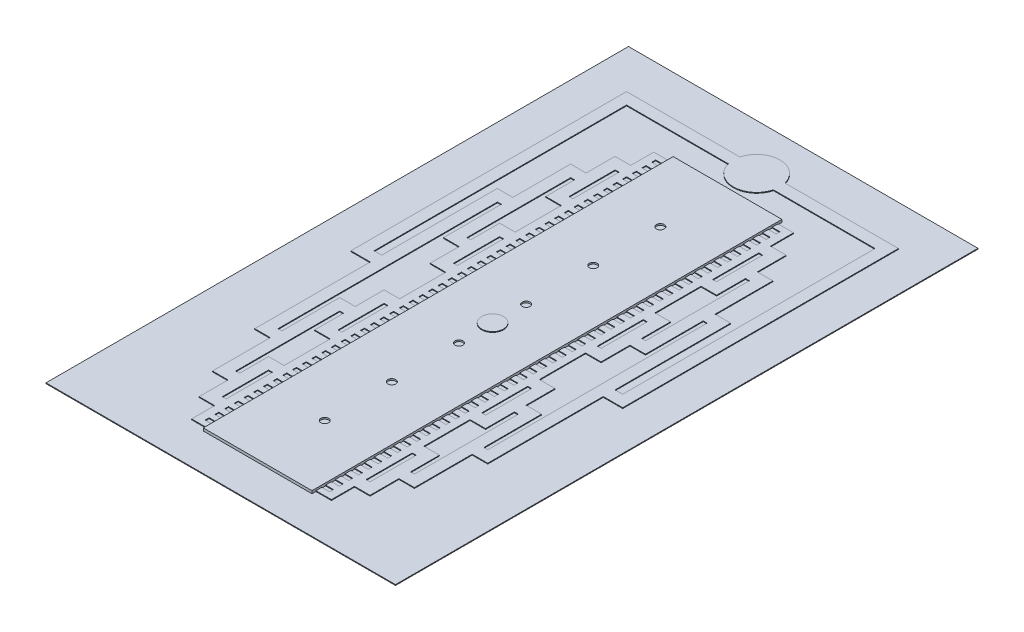
from build123d import *

# Parameters (mm, degrees)
SKETCH2_W           = 45
SKETCH2_H           = 75
BOSS_EXTRUDE1_DEPTH = 0.1
SKETCH3_W           = 14
SKETCH3_H           = 60.5
BOSS_EXTRUDE2_DEPTH = 0.35
SKETCH4_W           = 2
SKETCH4_H           = 59.5
BOSS_EXTRUDE3_DEPTH = 0.1
SKETCH5_W           = 1
SKETCH5_H           = 0.5
CUT_EXTRUDE1_DEPTH  = 0.1
BOSS_EXTRUDE4_DEPTH = 0.1
SKETCH7_R           = 1.4
BOSS_EXTRUDE5_DEPTH = 0.1
SKETCH8_R           = 0.5
CUT_EXTRUDE2_DEPTH  = 0.2
SKETCH9_W           = 45.00373836
SKETCH9_H           = 0.1
CUT_EXTRUDE3_DEPTH  = 2.5
SKETCH10_W          = 45.001662642
SKETCH10_H          = 0.1
BOSS_EXTRUDE6_DEPTH = 2.5


with BuildPart() as part:
    # Sketch2 → Boss-Extrude1 (new body)
    with BuildSketch(Plane(origin=(0, 0, 0), x_dir=(1, 0, 0), z_dir=(0, 1, 0))):
        Rectangle(SKETCH2_W, SKETCH2_H)
    extrude(amount=BOSS_EXTRUDE1_DEPTH)

    # Sketch3 → Boss-Extrude2 (add)
    with BuildSketch(Plane(origin=(0, 0.1, 0), x_dir=(1, 0, 0), z_dir=(0, 1, 0))):
        Rectangle(SKETCH3_W, SKETCH3_H)
    extrude(amount=BOSS_EXTRUDE2_DEPTH)

    # Sketch4 → Boss-Extrude3 (add)
    with BuildSketch(Plane(origin=(0, 0.1, 0), x_dir=(1, 0, 0), z_dir=(0, 1, 0))):
        with Locations((8, 0)):
            Rectangle(SKETCH4_W, SKETCH4_H)
        with Locations((-8, 0)):
            Rectangle(SKETCH4_W, SKETCH4_H)
    extrude(amount=BOSS_EXTRUDE3_DEPTH)

    # Sketch5 → Cut-Extrude1 (cut)
    with BuildSketch(Plane(origin=(0, 0.2, 0), x_dir=(1, 0, 0), z_dir=(0, 1, 0))):
        with Locations((7.5, 28.75)):
            Rectangle(SKETCH5_W, SKETCH5_H)
        with Locations((-7.5, 28.75)):
            Rectangle(SKETCH5_W, SKETCH5_H)
        with Locations((-7.5, 27.5)):
            Rectangle(SKETCH5_W, SKETCH5_H)
        with Locations((-7.5, 26.25)):
            Rectangle(SKETCH5_W, SKETCH5_H)
        with Locations((-7.5, 25)):
            Rectangle(SKETCH5_W, SKETCH5_H)
        with Locations((-7.5, 23.75)):
            Rectangle(SKETCH5_W, SKETCH5_H)
        with Locations((-7.5, 22.5)):
            Rectangle(SKETCH5_W, SKETCH5_H)
        with Locations((-7.5, 21.25)):
            Rectangle(SKETCH5_W, SKETCH5_H)
        with Locations((-7.5, 20)):
            Rectangle(SKETCH5_W, SKETCH5_H)
        with Locations((-7.5, 18.75)):
            Rectangle(SKETCH5_W, SKETCH5_H)
        with Locations((-7.5, 17.5)):
            Rectangle(SKETCH5_W, SKETCH5_H)
        with Locations((-7.5, 16.25)):
            Rectangle(SKETCH5_W, SKETCH5_H)
        with Locations((-7.5, 15)):
            Rectangle(SKETCH5_W, SKETCH5_H)
        with Locations((-7.5, 13.75)):
            Rectangle(SKETCH5_W, SKETCH5_H)
        with Locations((-7.5, 12.5)):
            Rectangle(SKETCH5_W, SKETCH5_H)
        with Locations((-7.5, 11.25)):
            Rectangle(SKETCH5_W, SKETCH5_H)
        with Locations((-7.5, 10)):
            Rectangle(SKETCH5_W, SKETCH5_H)
        with Locations((-7.5, 8.75)):
            Rectangle(SKETCH5_W, SKETCH5_H)
        with Locations((-7.5, 7.5)):
            Rectangle(SKETCH5_W, SKETCH5_H)
        with Locations((-7.5, 6.25)):
            Rectangle(SKETCH5_W, SKETCH5_H)
        with Locations((-7.5, 5)):
            Rectangle(SKETCH5_W, SKETCH5_H)
        with Locations((-7.5, 3.75)):
            Rectangle(SKETCH5_W, SKETCH5_H)
        with Locations((-7.5, 2.5)):
            Rectangle(SKETCH5_W, SKETCH5_H)
        with Locations((-7.5, 1.25)):
            Rectangle(SKETCH5_W, SKETCH5_H)
        with Locations((-7.5, 0)):
            Rectangle(SKETCH5_W, SKETCH5_H)
        with Locations((-7.5, -1.25)):
            Rectangle(SKETCH5_W, SKETCH5_H)
        with Locations((-7.5, -2.5)):
            Rectangle(SKETCH5_W, SKETCH5_H)
        with Locations((-7.5, -3.75)):
            Rectangle(SKETCH5_W, SKETCH5_H)
        with Locations((-7.5, -5)):
            Rectangle(SKETCH5_W, SKETCH5_H)
        with Locations((-7.5, -6.25)):
            Rectangle(SKETCH5_W, SKETCH5_H)
        with Locations((-7.5, -7.5)):
            Rectangle(SKETCH5_W, SKETCH5_H)
        with Locations((-7.5, -8.75)):
            Rectangle(SKETCH5_W, SKETCH5_H)
        with Locations((-7.5, -10)):
            Rectangle(SKETCH5_W, SKETCH5_H)
        with Locations((-7.5, -11.25)):
            Rectangle(SKETCH5_W, SKETCH5_H)
        with Locations((-7.5, -12.5)):
            Rectangle(SKETCH5_W, SKETCH5_H)
        with Locations((-7.5, -13.75)):
            Rectangle(SKETCH5_W, SKETCH5_H)
        with Locations((-7.5, -15)):
            Rectangle(SKETCH5_W, SKETCH5_H)
        with Locations((-7.5, -16.25)):
            Rectangle(SKETCH5_W, SKETCH5_H)
        with Locations((-7.5, -17.5)):
            Rectangle(SKETCH5_W, SKETCH5_H)
        with Locations((-7.5, -18.75)):
            Rectangle(SKETCH5_W, SKETCH5_H)
        with Locations((-7.5, -20)):
            Rectangle(SKETCH5_W, SKETCH5_H)
        with Locations((-7.5, -21.25)):
            Rectangle(SKETCH5_W, SKETCH5_H)
        with Locations((-7.5, -22.5)):
            Rectangle(SKETCH5_W, SKETCH5_H)
        with Locations((-7.5, -23.75)):
            Rectangle(SKETCH5_W, SKETCH5_H)
        with Locations((-7.5, -25)):
            Rectangle(SKETCH5_W, SKETCH5_H)
        with Locations((-7.5, -26.25)):
            Rectangle(SKETCH5_W, SKETCH5_H)
        with Locations((-7.5, -27.5)):
            Rectangle(SKETCH5_W, SKETCH5_H)
        with Locations((-7.5, -28.75)):
            Rectangle(SKETCH5_W, SKETCH5_H)
        with Locations((7.5, 27.5)):
            Rectangle(SKETCH5_W, SKETCH5_H)
        with Locations((7.5, 26.25)):
            Rectangle(SKETCH5_W, SKETCH5_H)
        with Locations((7.5, 25)):
            Rectangle(SKETCH5_W, SKETCH5_H)
        with Locations((7.5, 23.75)):
            Rectangle(SKETCH5_W, SKETCH5_H)
        with Locations((7.5, 22.5)):
            Rectangle(SKETCH5_W, SKETCH5_H)
        with Locations((7.5, 21.25)):
            Rectangle(SKETCH5_W, SKETCH5_H)
        with Locations((7.5, 20)):
            Rectangle(SKETCH5_W, SKETCH5_H)
        with Locations((7.5, 18.75)):
            Rectangle(SKETCH5_W, SKETCH5_H)
        with Locations((7.5, 17.5)):
            Rectangle(SKETCH5_W, SKETCH5_H)
        with Locations((7.5, 16.25)):
            Rectangle(SKETCH5_W, SKETCH5_H)
        with Locations((7.5, 15)):
            Rectangle(SKETCH5_W, SKETCH5_H)
        with Locations((7.5, 13.75)):
            Rectangle(SKETCH5_W, SKETCH5_H)
        with Locations((7.5, 12.5)):
            Rectangle(SKETCH5_W, SKETCH5_H)
        with Locations((7.5, 11.25)):
            Rectangle(SKETCH5_W, SKETCH5_H)
        with Locations((7.5, 10)):
            Rectangle(SKETCH5_W, SKETCH5_H)
        with Locations((7.5, 8.75)):
            Rectangle(SKETCH5_W, SKETCH5_H)
        with Locations((7.5, 7.5)):
            Rectangle(SKETCH5_W, SKETCH5_H)
        with Locations((7.5, 6.25)):
            Rectangle(SKETCH5_W, SKETCH5_H)
        with Locations((7.5, 5)):
            Rectangle(SKETCH5_W, SKETCH5_H)
        with Locations((7.5, 3.75)):
            Rectangle(SKETCH5_W, SKETCH5_H)
        with Locations((7.5, 2.5)):
            Rectangle(SKETCH5_W, SKETCH5_H)
        with Locations((7.5, 1.25)):
            Rectangle(SKETCH5_W, SKETCH5_H)
        with Locations((7.5, 0)):
            Rectangle(SKETCH5_W, SKETCH5_H)
        with Locations((7.5, -1.25)):
            Rectangle(SKETCH5_W, SKETCH5_H)
        with Locations((7.5, -2.5)):
            Rectangle(SKETCH5_W, SKETCH5_H)
        with Locations((7.5, -3.75)):
            Rectangle(SKETCH5_W, SKETCH5_H)
        with Locations((7.5, -5)):
            Rectangle(SKETCH5_W, SKETCH5_H)
        with Locations((7.5, -6.25)):
            Rectangle(SKETCH5_W, SKETCH5_H)
        with Locations((7.5, -7.5)):
            Rectangle(SKETCH5_W, SKETCH5_H)
        with Locations((7.5, -8.75)):
            Rectangle(SKETCH5_W, SKETCH5_H)
        with Locations((7.5, -10)):
            Rectangle(SKETCH5_W, SKETCH5_H)
        with Locations((7.5, -11.25)):
            Rectangle(SKETCH5_W, SKETCH5_H)
        with Locations((7.5, -12.5)):
            Rectangle(SKETCH5_W, SKETCH5_H)
        with Locations((7.5, -13.75)):
            Rectangle(SKETCH5_W, SKETCH5_H)
        with Locations((7.5, -15)):
            Rectangle(SKETCH5_W, SKETCH5_H)
        with Locations((7.5, -16.25)):
            Rectangle(SKETCH5_W, SKETCH5_H)
        with Locations((7.5, -17.5)):
            Rectangle(SKETCH5_W, SKETCH5_H)
        with Locations((7.5, -18.75)):
            Rectangle(SKETCH5_W, SKETCH5_H)
        with Locations((7.5, -20)):
            Rectangle(SKETCH5_W, SKETCH5_H)
        with Locations((7.5, -21.25)):
            Rectangle(SKETCH5_W, SKETCH5_H)
        with Locations((7.5, -22.5)):
            Rectangle(SKETCH5_W, SKETCH5_H)
        with Locations((7.5, -23.75)):
            Rectangle(SKETCH5_W, SKETCH5_H)
        with Locations((7.5, -25)):
            Rectangle(SKETCH5_W, SKETCH5_H)
        with Locations((7.5, -26.25)):
            Rectangle(SKETCH5_W, SKETCH5_H)
        with Locations((7.5, -27.5)):
            Rectangle(SKETCH5_W, SKETCH5_H)
        with Locations((7.5, -28.75)):
            Rectangle(SKETCH5_W, SKETCH5_H)
    extrude(amount=-CUT_EXTRUDE1_DEPTH, mode=Mode.SUBTRACT)

    # Sketch6 → Boss-Extrude4 (add)
    with BuildSketch(Plane(origin=(0, 0.1, 0), x_dir=(1, 0, 0), z_dir=(0, 1, 0))):
        with BuildLine():
            Line((-2.90473751, 34.75), (-17.5, 34.75))
            Line((-17.5, 34.75), (-17.5, -0.75))
            Line((-17.5, -0.75), (-15, -0.75))
            Line((-15, -0.75), (-15, -15.625))
            Line((-15, -15.625), (-13, -15.625))
            Line((-13, -15.625), (-13, -23.0625))
            Line((-13, -23.0625), (-11, -23.0625))
            Line((-11, -23.0625), (-11, -26.78125))
            Line((-11, -26.78125), (-9, -26.78125))
            Line((-9, -26.78125), (-9, -25.28125))
            Line((-9, -25.28125), (-9.5, -25.28125))
            Line((-9.5, -25.28125), (-9.5, -19.34375))
            Line((-9.5, -19.34375), (-9, -19.34375))
            Line((-9, -19.34375), (-9, -17.84375))
            Line((-9, -17.84375), (-11, -17.84375))
            Line((-11, -17.84375), (-11, -21.5625))
            Line((-11, -21.5625), (-11.5, -21.5625))
            Line((-11.5, -21.5625), (-11.5, -8.1875))
            Line((-11.5, -8.1875), (-11, -8.1875))
            Line((-11, -8.1875), (-11, -11.90625))
            Line((-11, -11.90625), (-9, -11.90625))
            Line((-9, -11.90625), (-9, -10.40625))
            Line((-9, -10.40625), (-9.5, -10.40625))
            Line((-9.5, -10.40625), (-9.5, -4.46875))
            Line((-9.5, -4.46875), (-9, -4.46875))
            Line((-9, -4.46875), (-9, -2.96875))
            Line((-9, -2.96875), (-11, -2.96875))
            Line((-11, -2.96875), (-11, -6.6875))
            Line((-11, -6.6875), (-13, -6.6875))
            Line((-13, -6.6875), (-13, -14.125))
            Line((-13, -14.125), (-13.5, -14.125))
            Line((-13.5, -14.125), (-13.5, 14.125))
            Line((-13.5, 14.125), (-13, 14.125))
            Line((-13, 14.125), (-13, 6.6875))
            Line((-13, 6.6875), (-11, 6.6875))
            Line((-11, 6.6875), (-11, 2.96875))
            Line((-11, 2.96875), (-9, 2.96875))
            Line((-9, 2.96875), (-9, 4.46875))
            Line((-9, 4.46875), (-9.5, 4.46875))
            Line((-9.5, 4.46875), (-9.5, 10.40625))
            Line((-9.5, 10.40625), (-9, 10.40625))
            Line((-9, 10.40625), (-9, 11.90625))
            Line((-9, 11.90625), (-11, 11.90625))
            Line((-11, 11.90625), (-11, 8.1875))
            Line((-11, 8.1875), (-11.5, 8.1875))
            Line((-11.5, 8.1875), (-11.5, 21.5625))
            Line((-11.5, 21.5625), (-11, 21.5625))
            Line((-11, 21.5625), (-11, 17.84375))
            Line((-11, 17.84375), (-9, 17.84375))
            Line((-9, 17.84375), (-9, 19.34375))
            Line((-9, 19.34375), (-9.5, 19.34375))
            Line((-9.5, 19.34375), (-9.5, 25.28125))
            Line((-9.5, 25.28125), (-9, 25.28125))
            Line((-9, 25.28125), (-9, 26.78125))
            Line((-9, 26.78125), (-11.022930545, 26.78125))
            Line((-11.022930545, 26.78125), (-11.022930545, 23.0625))
            Line((-11.022930545, 23.0625), (-13.022930545, 23.0625))
            Line((-13.022930545, 23.0625), (-13.022930545, 15.625))
            Line((-13.022930545, 15.625), (-15.022930545, 15.625))
            Line((-15.022930545, 15.625), (-15.022930545, 0.75))
            Line((-15.022930545, 0.75), (-16, 0.75))
            Line((-16, 0.75), (-16, 33.25))
            Line((-16, 33.25), (-2.90473751, 33.25))
            ThreePointArc((-2.90473751, 33.25), (0, 31), (2.90473751, 33.25))
            Line((2.90473751, 33.25), (16, 33.25))
            Line((16, 33.25), (16, 0.75))
            Line((16, 0.75), (15.022930545, 0.75))
            Line((15.022930545, 0.75), (15.022930545, 15.625))
            Line((15.022930545, 15.625), (13.022930545, 15.625))
            Line((13.022930545, 15.625), (13.022930545, 23.0625))
            Line((13.022930545, 23.0625), (11.022930545, 23.0625))
            Line((11.022930545, 23.0625), (11.022930545, 26.78125))
            Line((11.022930545, 26.78125), (9, 26.78125))
            Line((9, 26.78125), (9, 25.28125))
            Line((9, 25.28125), (9.5, 25.28125))
            Line((9.5, 25.28125), (9.5, 19.34375))
            Line((9.5, 19.34375), (9, 19.34375))
            Line((9, 19.34375), (9, 17.84375))
            Line((9, 17.84375), (11, 17.84375))
            Line((11, 17.84375), (11, 21.5625))
            Line((11, 21.5625), (11.5, 21.5625))
            Line((11.5, 21.5625), (11.5, 8.1875))
            Line((11.5, 8.1875), (11, 8.1875))
            Line((11, 8.1875), (11, 11.90625))
            Line((11, 11.90625), (9, 11.90625))
            Line((9, 11.90625), (9, 10.40625))
            Line((9, 10.40625), (9.5, 10.40625))
            Line((9.5, 10.40625), (9.5, 4.46875))
            Line((9.5, 4.46875), (9, 4.46875))
            Line((9, 4.46875), (9, 2.96875))
            Line((9, 2.96875), (11, 2.96875))
            Line((11, 2.96875), (11, 6.6875))
            Line((11, 6.6875), (13, 6.6875))
            Line((13, 6.6875), (13, 14.125))
            Line((13, 14.125), (13.5, 14.125))
            Line((13.5, 14.125), (13.5, -14.125))
            Line((13.5, -14.125), (13, -14.125))
            Line((13, -14.125), (13, -6.6875))
            Line((13, -6.6875), (11, -6.6875))
            Line((11, -6.6875), (11, -2.96875))
            Line((11, -2.96875), (9, -2.96875))
            Line((9, -2.96875), (9, -4.46875))
            Line((9, -4.46875), (9.5, -4.46875))
            Line((9.5, -4.46875), (9.5, -10.40625))
            Line((9.5, -10.40625), (9, -10.40625))
            Line((9, -10.40625), (9, -11.90625))
            Line((9, -11.90625), (11, -11.90625))
            Line((11, -11.90625), (11, -8.1875))
            Line((11, -8.1875), (11.5, -8.1875))
            Line((11.5, -8.1875), (11.5, -21.5625))
            Line((11.5, -21.5625), (11, -21.5625))
            Line((11, -21.5625), (11, -17.84375))
            Line((11, -17.84375), (9, -17.84375))
            Line((9, -17.84375), (9, -19.34375))
            Line((9, -19.34375), (9.5, -19.34375))
            Line((9.5, -19.34375), (9.5, -25.28125))
            Line((9.5, -25.28125), (9, -25.28125))
            Line((9, -25.28125), (9, -26.78125))
            Line((9, -26.78125), (11, -26.78125))
            Line((11, -26.78125), (11, -23.0625))
            Line((11, -23.0625), (13, -23.0625))
            Line((13, -23.0625), (13, -15.625))
            Line((13, -15.625), (15, -15.625))
            Line((15, -15.625), (15, -0.75))
            Line((15, -0.75), (17.5, -0.75))
            Line((17.5, -0.75), (17.5, 34.75))
            Line((17.5, 34.75), (2.90473751, 34.75))
            ThreePointArc((2.90473751, 34.75), (0, 37), (-2.90473751, 34.75))
        make_face()
    extrude(amount=BOSS_EXTRUDE4_DEPTH)

    # Sketch7 → Boss-Extrude5 (add)
    with BuildSketch(Plane(origin=(0, 0.45, 0), x_dir=(1, 0, 0), z_dir=(0, 1, 0))):
        Circle(SKETCH7_R)
    extrude(amount=BOSS_EXTRUDE5_DEPTH)

    # Sketch8 → Cut-Extrude2 (cut)
    with BuildSketch(Plane(origin=(0, 0.45, 0), x_dir=(1, 0, 0), z_dir=(0, 1, 0))):
        with Locations((0, 21.60714286)):
            Circle(SKETCH8_R)
        with Locations((0, 12.96428572)):
            Circle(SKETCH8_R)
        with Locations((0, 4.32142858)):
            Circle(SKETCH8_R)
        with Locations((0, -4.32142856)):
            Circle(SKETCH8_R)
        with Locations((0, -12.9642857)):
            Circle(SKETCH8_R)
        with Locations((0, -21.60714284)):
            Circle(SKETCH8_R)
    extrude(amount=-CUT_EXTRUDE2_DEPTH, mode=Mode.SUBTRACT)

    # Sketch9 → Cut-Extrude3 (cut)
    with BuildSketch(Plane.XY.offset(37.5)):
        with Locations((-0.00186918, 0.05)):
            Rectangle(SKETCH9_W, SKETCH9_H)
    extrude(amount=-CUT_EXTRUDE3_DEPTH, mode=Mode.SUBTRACT)

    # Sketch10 → Boss-Extrude6 (add)
    with BuildSketch(Plane(origin=(0, 0, -37.5), x_dir=(-1, 0, 0), z_dir=(0, 0, -1))):
        with Locations((0.000831321, 0.05)):
            Rectangle(SKETCH10_W, SKETCH10_H)
    extrude(amount=BOSS_EXTRUDE6_DEPTH)


solid = part.part
